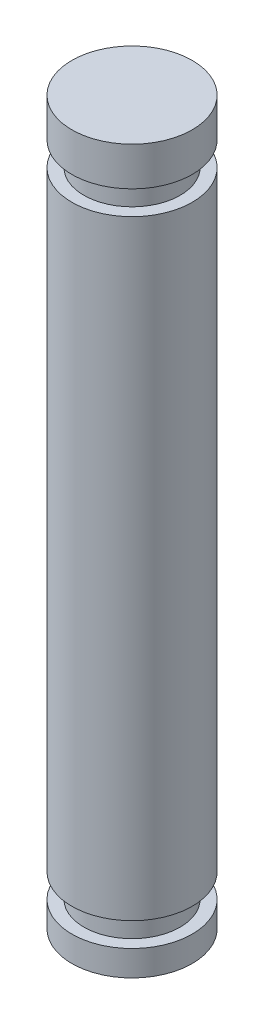
from build123d import *


with BuildPart() as part:
    # Sketch3 → Revolve1 (revolve)
    with BuildSketch(Plane(origin=(0, 0, 0), x_dir=(0, 0, -1), z_dir=(1, 0, 0))):
        Polygon((0, 120), (0, 0), (10, 0), (10, 4.243518426), (8, 4.243518426), (8, 8.243518426), (10, 8.243518426), (10, 109.568605079), (8, 109.568605079), (8, 113.568605079), (10, 113.568605079), (10, 120), align=None)
    revolve(axis=Axis((0, 0, 0), (0, 1, 0)))


solid = part.part
